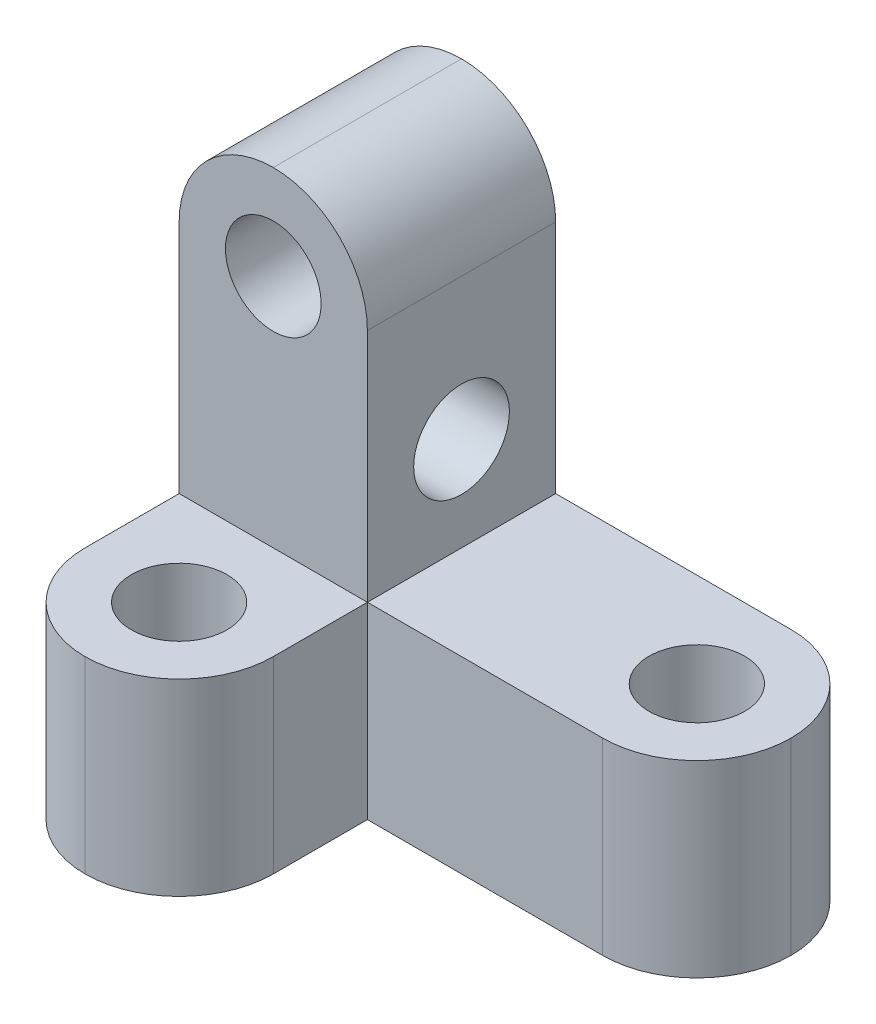
from build123d import *

# Parameters (mm, degrees)
SKETCH1_W           = 33
SKETCH1_H           = 24
BOSS_EXTRUDE1_DEPTH = 33
SKETCH2_W           = 21
SKETCH2_H           = 21
CUT_EXTRUDE1_DEPTH  = 53.478567054
SKETCH3_W           = 21
SKETCH3_H           = 12
CUT_EXTRUDE2_DEPTH  = 53.478567054
SKETCH4_W           = 12
SKETCH4_H           = 21
CUT_EXTRUDE3_DEPTH  = 53.478567054
SKETCH5_R           = 3.05
CUT_EXTRUDE4_DEPTH  = 53.478567054
SKETCH6_R           = 3.05
CUT_EXTRUDE5_DEPTH  = 53.478567054
SKETCH7_R           = 3.05
CUT_EXTRUDE6_DEPTH  = 53.478567054
FILLET1_R           = 6


with BuildPart() as part:
    # Sketch1 → Boss-Extrude1 (new body)
    with BuildSketch(Plane(origin=(0, 0, 0), x_dir=(1, 0, 0), z_dir=(0, 1, 0))):
        with Locations((16.5, -12)):
            Rectangle(SKETCH1_W, SKETCH1_H)
    extrude(amount=BOSS_EXTRUDE1_DEPTH)

    # Sketch2 → Cut-Extrude1 (cut, through all)
    with BuildSketch(Plane.XY.offset(24)):
        with Locations((22.5, 22.5)):
            Rectangle(SKETCH2_W, SKETCH2_H)
    extrude(amount=-CUT_EXTRUDE1_DEPTH, mode=Mode.SUBTRACT)

    # Sketch3 → Cut-Extrude2 (cut, through all)
    with BuildSketch(Plane.XZ):
        with Locations((22.5, 18)):
            Rectangle(SKETCH3_W, SKETCH3_H)
    extrude(amount=-CUT_EXTRUDE2_DEPTH, mode=Mode.SUBTRACT)

    # Sketch4 → Cut-Extrude3 (cut, through all)
    with BuildSketch(Plane.ZY):
        with Locations((18, 22.5)):
            Rectangle(SKETCH4_W, SKETCH4_H)
    extrude(amount=-CUT_EXTRUDE3_DEPTH, mode=Mode.SUBTRACT)

    # Sketch5 → Cut-Extrude4 (cut, through all)
    with BuildSketch(Plane.ZY):
        with Locations((6, 18)):
            Circle(SKETCH5_R)
    extrude(amount=-CUT_EXTRUDE4_DEPTH, mode=Mode.SUBTRACT)

    # Sketch6 → Cut-Extrude5 (cut, through all)
    with BuildSketch(Plane.XZ):
        with Locations(Location((6, 18, 0), (0, 0, 270))):
            Circle(SKETCH6_R)
        with Locations(Location((27, 6, 0), (0, 0, 270))):
            Circle(SKETCH6_R)
    extrude(amount=-CUT_EXTRUDE5_DEPTH, mode=Mode.SUBTRACT)

    # Sketch7 → Cut-Extrude6 (cut, through all)
    with BuildSketch(Plane(origin=(0, 0, 0), x_dir=(-1, 0, 0), z_dir=(0, 0, -1))):
        with Locations((-6, 27)):
            Circle(SKETCH7_R)
    extrude(amount=-CUT_EXTRUDE6_DEPTH, mode=Mode.SUBTRACT)

    # Fillet1
    fillet1_edges = [part.edges().sort_by_distance(p)[0] for p in [
        (12, 33, 6),
        (0, 33, 6),
        (33, 6, 0),
        (33, 6, 12),
        (0, 6, 24),
        (12, 6, 24),
    ]]
    fillet(fillet1_edges, radius=FILLET1_R - 0.0001)  # a hair under: the kernel refuses the full size


solid = part.part
